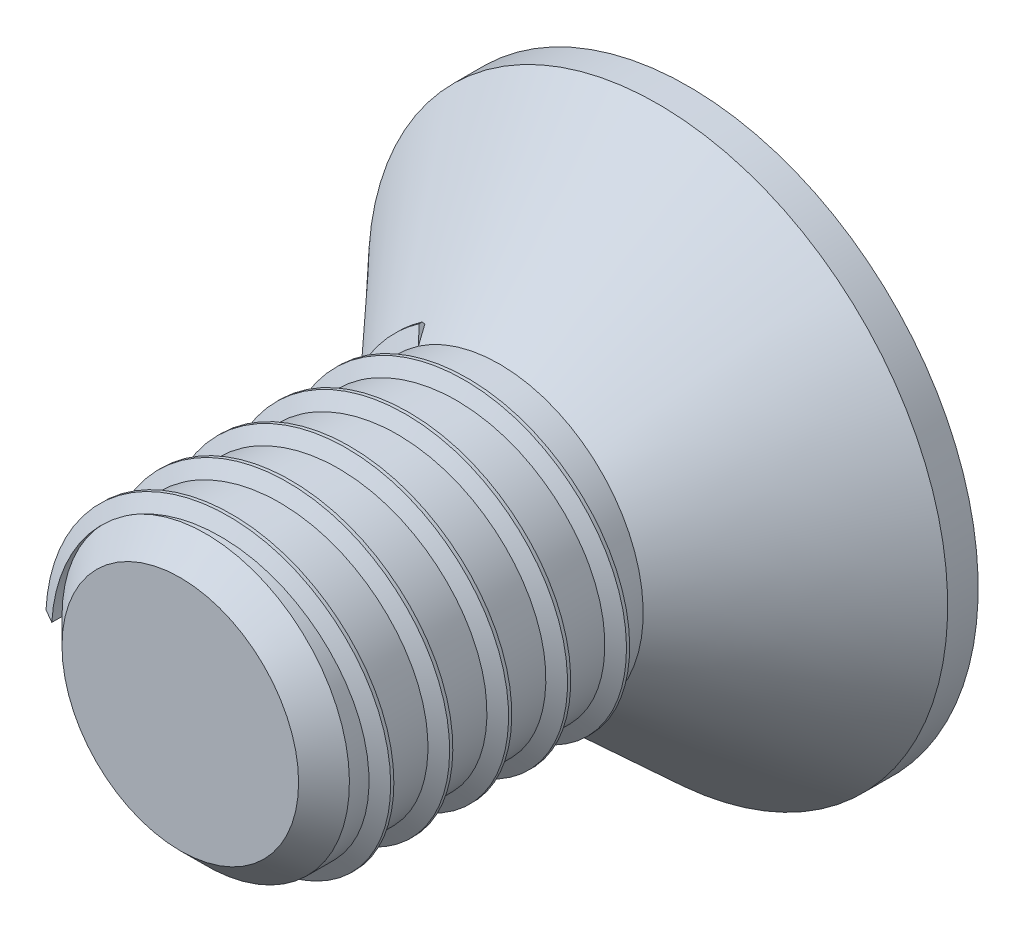
from build123d import *

# Parameters (mm, degrees)
CROQUIS1_R              = 1.41405
SALIENTE_EXTRUIR3_DEPTH = 3.14
CHAFL_N1_SIZE           = 0.25
ROSCA1_PITCH            = 0.58
CORTAR_EXTRUIR1_DEPTH   = 1.5
CHAFL_N2_SIZE           = 0.15


with BuildPart() as part:
    # Croquis1 → Saliente-Extruir3 (new body)
    with BuildSketch(Plane.XY):
        with Locations(Location((0, 0, 0), (0, 0, 180))):
            Circle(CROQUIS1_R)
    extrude(amount=SALIENTE_EXTRUIR3_DEPTH)

    # Croquis5 → Revolución1 (revolve)
    with BuildSketch(Plane(origin=(0, 0, 0), x_dir=(0, 0, -1), z_dir=(1, 0, 0)), mode=Mode.PRIVATE) as revoluci_n1_sk:
        Polygon((1.86, 2.85), (1.56, 2.85), (0, 1.41405), (0, 0), (1.86, 0), align=None)
    revolve(revoluci_n1_sk.sketch.rotate(Axis((0, 0, -1.86), (0, 0, 1)), 90), axis=Axis((0, 0, -1.86), (0, 0, 1)))

    # Chaflán1
    chafl_n1_edges = [part.edges().sort_by_distance(p)[0] for p in [
        (1.41405, 0, 3.14),
    ]]
    chamfer(chafl_n1_edges, length=CHAFL_N1_SIZE)

    # Rosca1: the profile of Perfil de rosca1 profile screwed along a right-hand helix of 5.155172 turns, 6 arcs to a turn; built about Z, then put on its axis
    rosca1_z = Axis((0, 0, 0), (0, 0, 1))
    rosca1_corners = [(1.41375, 0, -0.000173205), (1.549366469, 0, 0.078125), (1.549366469, 0, 0.109375), (1.41375, 0, 0.187673204)]
    with BuildLine(mode=Mode.PRIVATE) as rosca1_profile:
        Line(rosca1_corners[0], rosca1_corners[1])
        Line(rosca1_corners[1], rosca1_corners[2])
        Line(rosca1_corners[2], rosca1_corners[3])
        Line(rosca1_corners[3], rosca1_corners[0])
    rosca1_cap = Face(rosca1_profile.wire())
    rosca1_turn_angles = [0, 30, 60, 90, 120, 150, 180, 210, 240, 270, 300, 330, 360]
    rosca1_turn_weights = [1, 0.8660254037844387, 1, 0.8660254037844387, 1, 0.8660254037844387, 1, 0.8660254037844387, 1, 0.8660254037844387, 1, 0.8660254037844387, 1]
    rosca1_turn_rails = [Edge.make_bspline([Vector(p[0], p[1], 0).rotate(rosca1_z, rosca1_turn_angles[k]) / rosca1_turn_weights[k] + Vector(0, 0, p[2] + ROSCA1_PITCH * rosca1_turn_angles[k] / 360) for k in range(13)], [0, 0, 0, 1, 1, 2, 2, 3, 3, 4, 4, 5, 5, 6, 6, 6], 2, rosca1_turn_weights) for p in rosca1_corners]
    rosca1_turn_sides = [Face.make_surface_from_curves(rosca1_turn_rails[p[0]], rosca1_turn_rails[p[1]]) for p in [(0, 1), (1, 2), (2, 3), (3, 0)]]
    rosca1_last_angles = [1800, 1827.931034483, 1855.862068966]
    rosca1_last_weights = [1, 0.8835120444460137, 1]
    rosca1_last_rails = [Edge.make_bspline([Vector(p[0], p[1], 0).rotate(rosca1_z, rosca1_last_angles[k]) / rosca1_last_weights[k] + Vector(0, 0, p[2] + ROSCA1_PITCH * rosca1_last_angles[k] / 360) for k in range(3)], [0, 0, 0, 1, 1, 1], 2, rosca1_last_weights) for p in rosca1_corners]
    rosca1_last_sides = [Face.make_surface_from_curves(rosca1_last_rails[p[0]], rosca1_last_rails[p[1]]) for p in [(0, 1), (1, 2), (2, 3), (3, 0)]]
    rosca1 = Plane(origin=(0, 0, 2.99), x_dir=(-1, 0, 0), z_dir=(0, 0, -1)) * Solid(Shell([*[p.moved(Location((0, 0, ROSCA1_PITCH * i))) for i in range(5) for p in rosca1_turn_sides], *rosca1_last_sides, rosca1_cap, rosca1_cap.rotate(rosca1_z, 1855.862068966).moved(Location((0, 0, ROSCA1_PITCH * 1855.862068966 / 360)))]))
    add(rosca1)

    # Croquis16 → Cortar-Extruir1 (cut)
    with BuildSketch(Plane(origin=(0, 0, -1.86), x_dir=(-1, 0, 0), z_dir=(0, 0, -1))):
        Polygon((1.05, -0.606217783), (1.05, 0.606217783), (0, 1.212435565), (-1.05, 0.606217783), (-1.05, -0.606217783), (0, -1.212435565), align=None)
    extrude(amount=-CORTAR_EXTRUIR1_DEPTH, mode=Mode.SUBTRACT)

    # Chaflán2
    chafl_n2_edges = [part.edges().sort_by_distance(p)[0] for p in [
        (-0.525, -0.909326674, -0.36),
        (0.525, -0.909326674, -0.36),
        (1.05, 0, -0.36),
        (0.525, 0.909326674, -0.36),
        (-0.525, 0.909326674, -0.36),
        (-1.05, 0, -0.36),
    ]]
    chamfer(chafl_n2_edges, length=CHAFL_N2_SIZE)


solid = part.part
